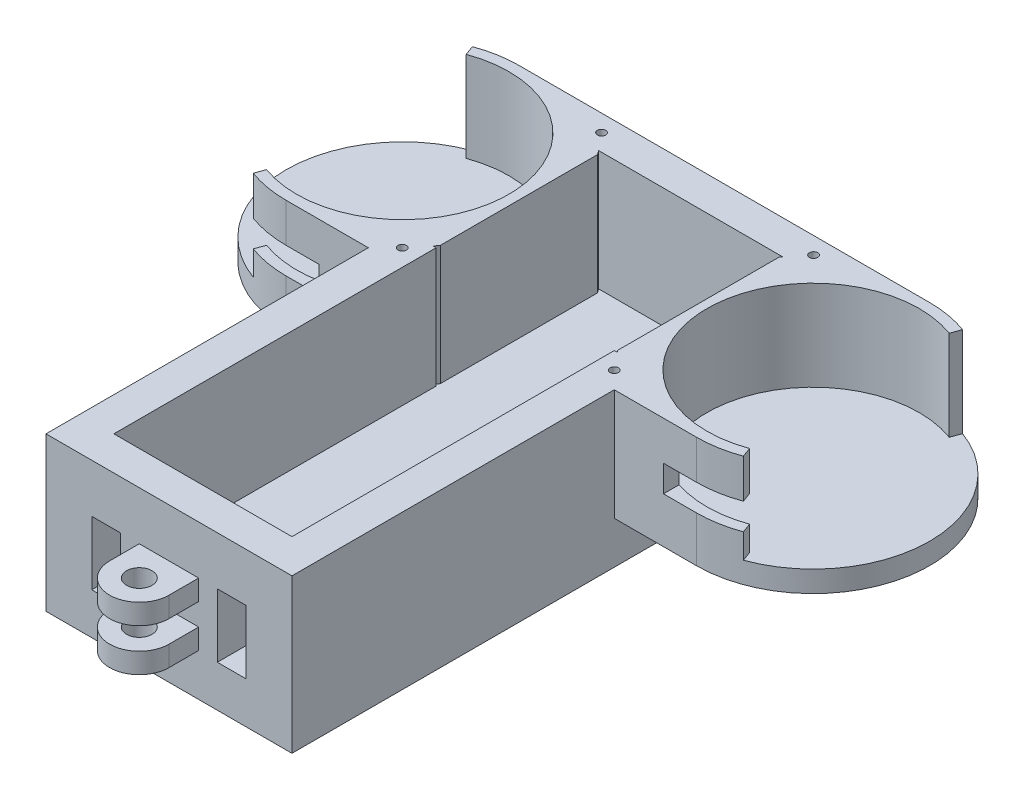
from build123d import *

# Parameters (mm, degrees)
BOSS_EXTRUDE1_DEPTH          = 26.9875
BOSS_EXTRUDE5_START          = -6.35
BOSS_EXTRUDE5_DEPTH          = 6.35
SKETCH3_W                    = 36.83
SKETCH3_H                    = 33.3375
BOSS_EXTRUDE7_DEPTH          = 96.52
SKETCH6_W                    = 8.89
SKETCH6_H                    = 33.3375
BOSS_EXTRUDE8_DEPTH          = 17.78
SKETCH7_W                    = 17.78
SKETCH7_H                    = 14.5415
SKETCH7_H_2                  = 6.604
CUT_EXTRUDE1_DEPTH           = 21.082
CUT_EXTRUDE2_DEPTH           = 30.48
F_3_0_3_DIAMETER_HOLE1_D     = 3
F_3_0_3_DIAMETER_HOLE1_DEPTH = 6.35
F_3_0_3_DIAMETER_HOLE1_TIP   = 0.901290929
SKETCH11_W                   = 25.093710248
SKETCH11_H                   = 7.9375
CUT_EXTRUDE3_DEPTH           = 13.716
SHELL1_START                 = -38.464523808
SHELL1_OUTLINE_W             = 53.34
SHELL1_OUTLINE_H             = 23.1775
SHELL1_DEPTH                 = 146.05
SHELL1_START_2               = 3.81
SHELL1_3_DEPTH               = 23.1775
SHELL1_4_DEPTH               = 23.1775
SKETCH14_W                   = 53.34
SKETCH14_H                   = 23.1775
CUT_EXTRUDE5_DEPTH           = 18.288
SKETCH16_W                   = 73.66
SKETCH16_H                   = 166.37
BOSS_EXTRUDE9_DEPTH          = 12.7
CUT_EXTRUDE6_START           = -12.7
CUT_EXTRUDE6_DEPTH           = 12.7
SKETCH18_W                   = 8.636
SKETCH18_H                   = 19.05
CUT_EXTRUDE7_DEPTH           = 20.828
SKETCH13_R                   = 1.2446
CUT_EXTRUDE4_DEPTH           = 50.8
SKETCH20_W                   = 53.781966305
SKETCH20_H                   = 49.53
CUT_EXTRUDE8_DEPTH           = 35.8775


with BuildPart() as part:
    # Sketch1 → Boss-Extrude1 (new body)
    with BuildSketch(Plane(origin=(0, 0, 0), x_dir=(1, 0, 0), z_dir=(0, 1, 0))):
        with BuildLine():
            ThreePointArc((-27.606252307, 13.699523808), (-37.835547974, 38.395228141), (-62.531252307, 48.624523808))
            Line((-62.531252307, 48.624523808), (-62.531252307, 45.513023808))
            ThreePointArc((-62.531252307, 45.513023808), (-40.035710723, 36.195065391), (-30.717752307, 13.699523808))
            ThreePointArc((-30.717752307, 13.699523808), (-40.035710723, -8.796017775), (-62.531252307, -18.113976192))
            Line((-62.531252307, -18.113976192), (-62.531252307, -21.225476192))
            ThreePointArc((-62.531252307, -21.225476192), (-37.835547974, -10.996180525), (-27.606252307, 13.699523808))
        make_face()
        with BuildLine():
            Line((-62.531252307, 45.513023808), (-62.531252307, 48.624523808))
            ThreePointArc((-62.531252307, 48.624523808), (-68.595914912, 48.093934582), (-74.476305812, 46.518288589))
            Line((-74.476305812, 46.518288589), (-73.412110136, 43.594434999))
            ThreePointArc((-73.412110136, 43.594434999), (-68.055608607, 45.029705258), (-62.531252307, 45.513023808))
        make_face()
        with BuildLine():
            ThreePointArc((-74.476305812, -19.119240973), (-68.595914912, -20.694886966), (-62.531252307, -21.225476192))
            Line((-62.531252307, -21.225476192), (-62.531252307, -18.113976192))
            ThreePointArc((-62.531252307, -18.113976192), (-68.055608607, -17.630657643), (-73.412110136, -16.195387383))
            Line((-73.412110136, -16.195387383), (-74.476305812, -19.119240973))
        make_face()
        with BuildLine():
            Line((-1.088243621, 48.624523808), (-62.531252307, 48.624523808))
            ThreePointArc((-62.531252307, 48.624523808), (-37.835547974, 38.395228141), (-27.606252307, 13.699523808))
            ThreePointArc((-27.606252307, 13.699523808), (-37.835547974, -10.996180525), (-62.531252307, -21.225476192))
            Line((-62.531252307, -21.225476192), (-1.088243621, -21.225476192))
            Line((-1.088243621, -21.225476192), (-1.088243621, 48.624523808))
        make_face()
    boss_extrude1 = extrude(amount=BOSS_EXTRUDE1_DEPTH)

    # Sketch1<5> → Boss-Extrude5 (add)
    with BuildSketch(Plane(origin=(0, 0, 0), x_dir=(1, 0, 0), z_dir=(0, 1, 0)).offset(BOSS_EXTRUDE5_START)):
        with BuildLine():
            Line((-62.531252307, -21.225476192), (-1.088243621, -21.225476192))
            Line((-1.088243621, -21.225476192), (-1.088243621, 48.624523808))
            Line((-1.088243621, 48.624523808), (-62.531252307, 48.624523808))
            ThreePointArc((-62.531252307, 48.624523808), (-97.456252307, 13.699523808), (-62.531252307, -21.225476192))
        make_face()
    boss_extrude5 = extrude(amount=BOSS_EXTRUDE5_DEPTH)

    # Mirror1: Boss-Extrude1, Boss-Extrude5 across plane
    add(boss_extrude1.mirror(Plane(origin=(-1.088243621, 26.9875, 0), x_dir=(0, 0, 1), z_dir=(1, 0, 0))))
    add(boss_extrude5.mirror(Plane(origin=(-1.088243621, 26.9875, 0), x_dir=(0, 0, 1), z_dir=(1, 0, 0))))

    # Sketch3 → Boss-Extrude7 (add)
    with BuildSketch(Plane.XY.offset(21.225476192)):
        with Locations((-19.503243621, 10.31875)):
            Rectangle(SKETCH3_W, SKETCH3_H)
        with Locations((17.326756379, 10.31875)):
            Rectangle(SKETCH3_W, SKETCH3_H)
    extrude(amount=BOSS_EXTRUDE7_DEPTH)

    # Sketch6 → Boss-Extrude8 (add)
    with BuildSketch(Plane.XY.offset(117.745476192)):
        with Locations((-5.533243621, 10.31875)):
            Rectangle(SKETCH6_W, SKETCH6_H)
        with Locations((3.356756379, 10.31875)):
            Rectangle(SKETCH6_W, SKETCH6_H)
    extrude(amount=BOSS_EXTRUDE8_DEPTH)

    # Sketch7 → Cut-Extrude1 (cut)
    with BuildSketch(Plane.ZY.offset(9.978243621)):
        with Locations((126.635476192, 19.71675)):
            Rectangle(SKETCH7_W, SKETCH7_H)
        with Locations((126.635476192, 3.048)):
            Rectangle(SKETCH7_W, SKETCH7_H_2)
    extrude(amount=-CUT_EXTRUDE1_DEPTH, mode=Mode.SUBTRACT)

    # Sketch8 → Cut-Extrude2 (cut)
    with BuildSketch(Plane(origin=(0, 12.446, 0), x_dir=(1, 0, 0), z_dir=(0, 1, 0))):
        with BuildLine():
            Line((-9.978243621, -135.525476192), (-1.088243621, -135.525476192))
            ThreePointArc((-1.088243621, -135.525476192), (-7.374422906, -132.921655477), (-9.978243621, -126.635476192))
            Line((-9.978243621, -126.635476192), (-9.978243621, -135.525476192))
        make_face()
        with BuildLine():
            Line((7.801756379, -135.525476192), (7.801756379, -126.635476192))
            ThreePointArc((7.801756379, -126.635476192), (5.197935664, -132.921655477), (-1.088243621, -135.525476192))
            Line((-1.088243621, -135.525476192), (7.801756379, -135.525476192))
        make_face()
        with BuildLine():
            ThreePointArc((-4.898243621, -126.635476192), (-1.088243621, -130.445476192), (2.721756379, -126.635476192))
            Line((2.721756379, -126.635476192), (-4.898243621, -126.635476192))
        make_face()
        with BuildLine():
            Line((-4.898243621, -126.635476192), (2.721756379, -126.635476192))
            ThreePointArc((2.721756379, -126.635476192), (-1.088243621, -122.825476192), (-4.898243621, -126.635476192))
        make_face()
    extrude(amount=-CUT_EXTRUDE2_DEPTH, mode=Mode.SUBTRACT)

    # Ø3.0 (3) Diameter Hole1
    with Locations(Plane(origin=(-12.518243621, -6.35, 114.252976192), x_dir=(0, 0, -1), z_dir=(0, -1, 0))):
        with Locations((0, 0), (4.0005, 0), (8.001, 0)):
            Hole(F_3_0_3_DIAMETER_HOLE1_D / 2, depth=F_3_0_3_DIAMETER_HOLE1_DEPTH)
            with Locations((0, 0, -(F_3_0_3_DIAMETER_HOLE1_DEPTH + F_3_0_3_DIAMETER_HOLE1_TIP / 2))):  # 118° drill point
                Cone(0, F_3_0_3_DIAMETER_HOLE1_D / 2, F_3_0_3_DIAMETER_HOLE1_TIP, mode=Mode.SUBTRACT)

    # Sketch11 → Cut-Extrude3 (cut)
    with BuildSketch(Plane.XY.offset(21.225476192)):
        with Locations((-65.197098745, 11.33475)):
            Rectangle(SKETCH11_W, SKETCH11_H)
    cut_extrude3 = extrude(amount=-CUT_EXTRUDE3_DEPTH, mode=Mode.SUBTRACT)

    # Mirror2: Cut-Extrude3 across plane
    add(cut_extrude3.mirror(Plane.ZY.offset(1.088243621)), mode=Mode.SUBTRACT)

    # Shell1: read off the stored shape, not the designer's step
    # Shell1 outline → Shell1 (cut)
    with BuildSketch(Plane.XY.offset(SHELL1_START)):
        with Locations((-1.088243621, 15.39875)):
            Rectangle(SHELL1_OUTLINE_W, SHELL1_OUTLINE_H)
    extrude(amount=SHELL1_DEPTH, mode=Mode.SUBTRACT)

    # Shell1 2 outline → Shell1 2 (revolve)
    with BuildSketch(Plane(origin=(-12.518243621, 0, 106.251976192), x_dir=(1, 0, 0), z_dir=(0, 0, 1))):
        Polygon((11.66, 3.81), (11.66, 5.748251426), (0, 12.754286244), (0, 3.81), align=None)
    revolve(axis=Axis((-12.518243621, 0, 106.251976192), (0, 1, 0)))

    # Shell1 3 outline → Shell1 3 (cut)
    with BuildSketch(Plane(origin=(0, 0, 0), x_dir=(1, 0, 0), z_dir=(0, 1, 0)).offset(SHELL1_START_2)):
        with BuildLine():
            ThreePointArc((-27.758243621, -9.808189165), (-28.194454791, -10.440878812), (-28.642176231, -11.065476192))
            Line((-28.642176231, -11.065476192), (-27.758243621, -11.065476192))
            Line((-27.758243621, -11.065476192), (-27.758243621, -9.808189165))
        make_face()
        with BuildLine():
            ThreePointArc((26.46568899, -11.065476192), (26.01796755, -10.440878811), (25.581756379, -9.808189163))
            Line((25.581756379, -9.808189163), (25.581756379, -11.065476192))
            Line((25.581756379, -11.065476192), (26.46568899, -11.065476192))
        make_face()
        with BuildLine():
            Line((26.46568899, 38.464523808), (25.581756379, 38.464523808))
            Line((25.581756379, 38.464523808), (25.581756379, 37.207236779))
            ThreePointArc((25.581756379, 37.207236779), (26.01796755, 37.839926427), (26.46568899, 38.464523808))
        make_face()
        with BuildLine():
            ThreePointArc((-28.642176231, 38.464523808), (-28.194454791, 37.839926428), (-27.758243621, 37.207236781))
            Line((-27.758243621, 37.207236781), (-27.758243621, 38.464523808))
            Line((-27.758243621, 38.464523808), (-28.642176231, 38.464523808))
        make_face()
        with BuildLine():
            Line((-10.554813524, -117.745476192), (-14.481673718, -117.745476192))
            ThreePointArc((-14.481673718, -117.745476192), (-12.518243621, -117.911976192), (-10.554813524, -117.745476192))
        make_face()
    extrude(amount=SHELL1_3_DEPTH, mode=Mode.SUBTRACT)

    # Shell1 4 outline → Shell1 4 (add)
    with BuildSketch(Plane(origin=(0, 0, 0), x_dir=(1, 0, 0), z_dir=(0, 1, 0)).offset(SHELL1_START_2)):
        with BuildLine():
            Line((25.581756379, -9.808189163), (25.581756379, 37.207236779))
            ThreePointArc((25.581756379, 37.207236779), (18.381265065, 13.699523808), (25.581756379, -9.808189163))
        make_face()
        with BuildLine():
            Line((-27.758243621, 37.207236781), (-27.758243621, -9.808189165))
            ThreePointArc((-27.758243621, -9.808189165), (-20.557752307, 13.699523808), (-27.758243621, 37.207236781))
        make_face()
    extrude(amount=SHELL1_4_DEPTH)

    # Sketch14 → Cut-Extrude5 (cut)
    with BuildSketch(Plane(origin=(0, 0, 107.585476192), x_dir=(-1, 0, 0), z_dir=(0, 0, -1))):
        with Locations((1.088243621, 15.39875)):
            Rectangle(SKETCH14_W, SKETCH14_H)
    extrude(amount=CUT_EXTRUDE5_DEPTH, mode=Mode.SUBTRACT)

    # Sketch16 → Boss-Extrude9 (add)
    with BuildSketch(Plane.XZ.offset(6.35)):
        with Locations((-1.088243621, 34.560476192)):
            Rectangle(SKETCH16_W, SKETCH16_H)
    extrude(amount=BOSS_EXTRUDE9_DEPTH)

    # Sketch17 → Cut-Extrude6 (cut)
    with BuildSketch(Plane(origin=(0, 3.81, 0), x_dir=(1, 0, 0), z_dir=(0, 1, 0)).offset(CUT_EXTRUDE6_START)):
        with BuildLine():
            Line((-28.642176231, 38.464523808), (26.46568899, 38.464523808))
            ThreePointArc((26.46568899, 38.464523808), (18.381265065, 13.699523808), (26.46568899, -11.065476192))
            Line((26.46568899, -11.065476192), (25.581756379, -11.065476192))
            Line((25.581756379, -11.065476192), (25.581756379, -107.585476192))
            Line((25.581756379, -107.585476192), (-27.758243621, -107.585476192))
            Line((-27.758243621, -107.585476192), (-27.758243621, -11.065476192))
            Line((-27.758243621, -11.065476192), (-28.642176231, -11.065476192))
            ThreePointArc((-28.642176231, -11.065476192), (-20.557752307, 13.699523808), (-28.642176231, 38.464523808))
        make_face()
    extrude(amount=CUT_EXTRUDE6_DEPTH, mode=Mode.SUBTRACT)

    # Sketch18 → Cut-Extrude7 (cut)
    with BuildSketch(Plane.XY.offset(117.745476192)):
        with Locations((-19.884243621, 2.921)):
            Rectangle(SKETCH18_W, SKETCH18_H)
        with Locations((17.707756379, 2.921)):
            Rectangle(SKETCH18_W, SKETCH18_H)
    extrude(amount=-CUT_EXTRUDE7_DEPTH, mode=Mode.SUBTRACT)

    # Sketch13 → Cut-Extrude4 (cut)
    with BuildSketch(Plane(origin=(0, 26.9875, 0), x_dir=(1, 0, 0), z_dir=(0, 1, 0))):
        with Locations(Location((30.661756379, -16.145476192, 0), (0, 0, 270))):
            Circle(SKETCH13_R)
        with Locations(Location((-32.838243621, -16.145476192, 0), (0, 0, 270))):
            Circle(SKETCH13_R)
        with Locations(Location((-32.838243621, 43.544523808, 0), (0, 0, 270))):
            Circle(SKETCH13_R)
        with Locations(Location((30.661756379, 43.544523808, 0), (0, 0, 270))):
            Circle(SKETCH13_R)
    extrude(amount=-CUT_EXTRUDE4_DEPTH, mode=Mode.SUBTRACT)

    # Sketch20 → Cut-Extrude8 (cut)
    with BuildSketch(Plane(origin=(0, 26.9875, 0), x_dir=(1, 0, 0), z_dir=(0, 1, 0))):
        with Locations((-0.867260468, 13.699523808)):
            Rectangle(SKETCH20_W, SKETCH20_H)
    extrude(amount=-CUT_EXTRUDE8_DEPTH, mode=Mode.SUBTRACT)


solid = part.part
